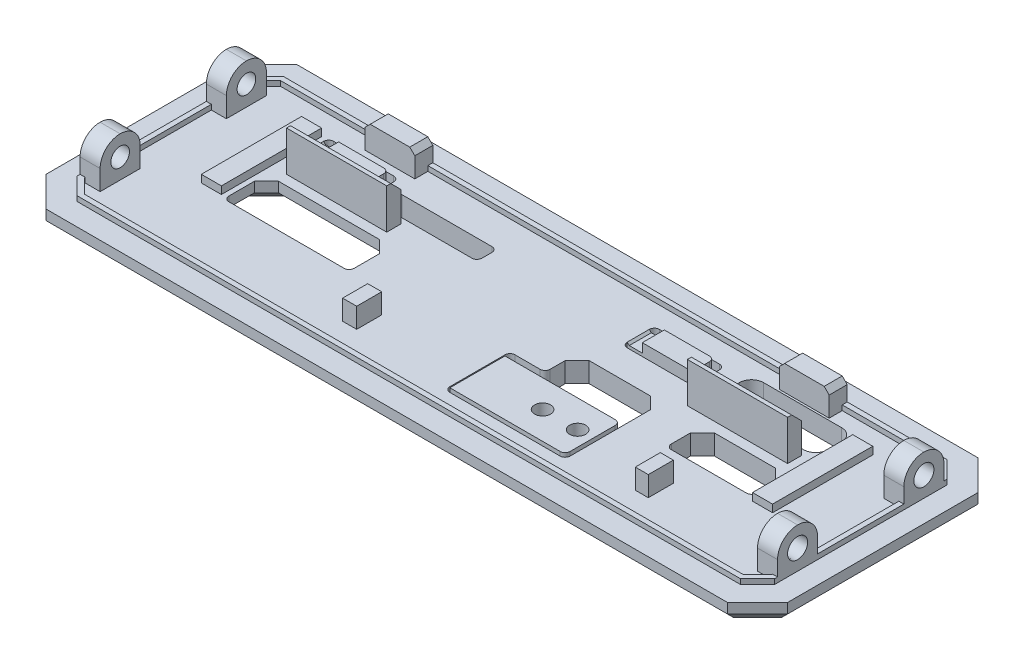
from build123d import *

# Parameters (mm, degrees)
EXTRUDE_1_DEPTH               = 2
CHAMFER_1_SIZE                = 1
CUT_EXTRUDE_1_REACH           = 46.22
SKETCH_3_W                    = 12.5
SKETCH_3_H                    = 4.25
SKETCH_3_W_2                  = 8.5
SKETCH_3_H_2                  = 3.6
SKETCH_3_W_3                  = 10.2
SKETCH_3_H_3                  = 3.8
SKETCH_3_W_4                  = 7
SKETCH_3_H_4                  = 3.2
SKETCH_3_W_5                  = 10
SKETCH_3_H_5                  = 2
FILLET_1_R                    = 1.2
FILLET_2_R                    = 0.5
CHAMFER_2_SIZE                = 1.2
SKETCH_4_W                    = 3.5
SKETCH_4_H                    = 2.2
EXTRUDE_2_DEPTH               = 1
SKETCH_4_W_2                  = 6.5
SKETCH_4_H_2                  = 5.5
EXTRUDE_2_2_DEPTH             = 1
SKETCH_4_W_3                  = 4.5
EXTRUDE_2_3_DEPTH             = 1
SKETCH_5_W                    = 6.5
SKETCH_5_H                    = 2.2
EXTRUDE_3_DEPTH               = 0.8
SKETCH_16_W                   = 5
SKETCH_16_H                   = 2.2
EXTRUDE_10_DEPTH              = 0.9
SKETCH_6_W                    = 11.5
SKETCH_6_H                    = 5.5
EXTRUDE_4_DEPTH               = 0.9
FILLET_5_R                    = 1
FILLET_3_R                    = 0.5
CHAMFER_3_SIZE                = 0.2
SKETCH_7_W                    = 1.4
SKETCH_7_H                    = 2.5
SKETCH_7_W_2                  = 1.3
EXTRUDE_5_DEPTH               = 2
SKETCH_11_W                   = 2
SKETCH_11_H                   = 10
EXTRUDE_7_DEPTH               = 0.75
SKETCH_8_W                    = 2
SKETCH_8_H                    = 4
EXTRUDE_6_DEPTH               = 4
FILLET_4_R                    = 2
SKETCH_9_R                    = 1
CUT_EXTRUDE_2_DEPTH           = 2
CUT_EXTRUDE_2_DRAFT           = -2
CUT_EXTRUDE_2_PROFILE_2_DEPTH = 2
CUT_EXTRUDE_2_PROFILE_2_DRAFT = -2
SKETCH_10_R                   = 1
CUT_EXTRUDE_3_DEPTH           = 2
CUT_EXTRUDE_3_DRAFT           = -2
CUT_EXTRUDE_3_PROFILE_2_DEPTH = 2
CUT_EXTRUDE_3_PROFILE_2_DRAFT = -2
CUT_EXTRUDE_4_REACH           = 46.58
SKETCH_14_R                   = 0.8
EXTRUDE_11_DEPTH              = 0.5
CHAMFER_6_SIZE                = 1
SKETCH_18_W                   = 10
SKETCH_18_H                   = 1.4
EXTRUDE_12_DEPTH              = 4
CHAMFER_7_SIZE                = 1
SKETCH_19_W                   = 4.95
SKETCH_19_H                   = 1.8
EXTRUDE_13_DEPTH              = 2.5
CHAMFER_8_SIZE                = 0.5


# Some blends are built 0.0001 mm under size
with BuildPart() as part:
    # 草图2 → 凸台-拉伸1 (new body)
    with BuildSketch(Plane(origin=(0, 0, 0), x_dir=(1, 0, 0), z_dir=(0, 1, 0))):
        Polygon((-36.762377201, 20.76395027), (-33.762377201, 23.76395027), (34.237622799, 23.76395027), (37.237622799, 20.76395027), (37.237622799, 1.76395027), (34.237622799, -1.23604973), (-33.762377201, -1.23604973), (-36.762377201, 1.76395027), align=None)
    extrude(amount=EXTRUDE_1_DEPTH)

    # 倒角1
    chamfer_1_edges = [part.edges().sort_by_distance(p)[0] for p in [
        (-35.262377201, 0, -0.26395027),
        (-36.762377201, 0, -11.26395027),
        (-35.262377201, 0, -22.26395027),
        (0.237622799, 0, -23.76395027),
        (35.737622799, 0, -22.26395027),
        (37.237622799, 0, -11.26395027),
        (35.737622799, 0, -0.26395027),
        (0.237622799, 0, 1.23604973),
    ]]
    chamfer(chamfer_1_edges, length=CHAMFER_1_SIZE)

    # 草图3 → 切除-拉伸1 (cut, up to next)
    with BuildSketch(Plane.XZ, mode=Mode.PRIVATE) as cut_extrude_1_sk1:
        with Locations((-19.512377201, -10.63895027)):
            Rectangle(SKETCH_3_W, SKETCH_3_H)
    cut_extrude_1_tool1 = extrude(cut_extrude_1_sk1.sketch, amount=-CUT_EXTRUDE_1_REACH, mode=Mode.PRIVATE) & part.part
    # 草图3 → 切除-拉伸1 (cut, up to next)
    with BuildSketch(Plane.XZ, mode=Mode.PRIVATE) as cut_extrude_1_sk2:
        Polygon((1.737622799, -3.06395027), (13.737622799, -3.06395027), (13.737622799, -12.76395027), (5.237622799, -12.76395027), (5.237622799, -9.56395027), (1.737622799, -9.56395027), align=None)
    cut_extrude_1_tool2 = extrude(cut_extrude_1_sk2.sketch, amount=-CUT_EXTRUDE_1_REACH, mode=Mode.PRIVATE) & part.part
    # 草图3 → 切除-拉伸1 (cut, up to next)
    with BuildSketch(Plane.XZ, mode=Mode.PRIVATE) as cut_extrude_1_sk3:
        with Locations((21.987622799, -10.96395027)):
            Rectangle(SKETCH_3_W_2, SKETCH_3_H_2)
    cut_extrude_1_tool3 = extrude(cut_extrude_1_sk3.sketch, amount=-CUT_EXTRUDE_1_REACH, mode=Mode.PRIVATE) & part.part
    # 草图3 → 切除-拉伸1 (cut, up to next)
    with BuildSketch(Plane.XZ, mode=Mode.PRIVATE) as cut_extrude_1_sk4:
        with Locations((20.937622799, -17.66395027)):
            Rectangle(SKETCH_3_W_3, SKETCH_3_H_3)
    cut_extrude_1_tool4 = extrude(cut_extrude_1_sk4.sketch, amount=-CUT_EXTRUDE_1_REACH, mode=Mode.PRIVATE) & part.part
    # 草图3 → 切除-拉伸1 (cut, up to next)
    with BuildSketch(Plane.XZ, mode=Mode.PRIVATE) as cut_extrude_1_sk5:
        with Locations((10.237622799, -17.36395027)):
            Rectangle(SKETCH_3_W_4, SKETCH_3_H_4)
    cut_extrude_1_tool5 = extrude(cut_extrude_1_sk5.sketch, amount=-CUT_EXTRUDE_1_REACH, mode=Mode.PRIVATE) & part.part
    # 草图3 → 切除-拉伸1 (cut, up to next)
    with BuildSketch(Plane.XZ, mode=Mode.PRIVATE) as cut_extrude_1_sk6:
        with Locations((-22.262377201, -17.36395027)):
            Rectangle(SKETCH_3_W_4, SKETCH_3_H_4)
    cut_extrude_1_tool6 = extrude(cut_extrude_1_sk6.sketch, amount=-CUT_EXTRUDE_1_REACH, mode=Mode.PRIVATE) & part.part
    # 草图3 → 切除-拉伸1 (cut, up to next)
    with BuildSketch(Plane.XZ, mode=Mode.PRIVATE) as cut_extrude_1_sk7:
        with Locations((-12.762377201, -16.76395027)):
            Rectangle(SKETCH_3_W_5, SKETCH_3_H_5)
    cut_extrude_1_tool7 = extrude(cut_extrude_1_sk7.sketch, amount=-CUT_EXTRUDE_1_REACH, mode=Mode.PRIVATE) & part.part
    add(cut_extrude_1_tool1.solids().sort_by_distance((-19.512377, 0, -10.63895))[0], mode=Mode.SUBTRACT)
    add(cut_extrude_1_tool2.solids().sort_by_distance((8.190094, 0, -7.567943))[0], mode=Mode.SUBTRACT)
    add(cut_extrude_1_tool3.solids().sort_by_distance((21.987623, 0, -10.96395))[0], mode=Mode.SUBTRACT)
    add(cut_extrude_1_tool4.solids().sort_by_distance((20.937623, 0, -17.66395))[0], mode=Mode.SUBTRACT)
    add(cut_extrude_1_tool5.solids().sort_by_distance((10.237623, 0, -17.36395))[0], mode=Mode.SUBTRACT)
    add(cut_extrude_1_tool6.solids().sort_by_distance((-22.262377, 0, -17.36395))[0], mode=Mode.SUBTRACT)
    add(cut_extrude_1_tool7.solids().sort_by_distance((-12.762377, 0, -16.76395))[0], mode=Mode.SUBTRACT)

    # 圆角1
    fillet_1_edges = [part.edges().sort_by_distance(p)[0] for p in [
        (15.837622799, 1, -19.56395027),
        (15.837622799, 1, -15.76395027),
        (26.037622799, 1, -15.76395027),
        (26.037622799, 1, -19.56395027),
    ]]
    fillet(fillet_1_edges, radius=FILLET_1_R)

    # 圆角2
    fillet_2_edges = [part.edges().sort_by_distance(p)[0] for p in [
        (17.737622799, 1, -9.16395027),
        (26.237622799, 1, -9.16395027),
        (1.737622799, 1, -9.56395027),
        (1.737622799, 1, -3.06395027),
        (13.737622799, 1, -3.06395027),
        (5.237622799, 1, -9.56395027),
        (-25.762377201, 1, -8.51395027),
        (-13.262377201, 1, -8.51395027),
        (-17.762377201, 1, -17.76395027),
        (-17.762377201, 1, -15.76395027),
        (-7.762377201, 1, -15.76395027),
        (-7.762377201, 1, -17.76395027),
        (-25.762377201, 1, -18.96395027),
        (-25.762377201, 1, -15.76395027),
        (-18.762377201, 1, -15.76395027),
        (-18.762377201, 1, -18.96395027),
        (6.737622799, 1, -18.96395027),
        (6.737622799, 1, -15.76395027),
        (13.737622799, 1, -15.76395027),
        (13.737622799, 1, -18.96395027),
    ]]
    fillet(fillet_2_edges, radius=FILLET_2_R)

    # 倒角2
    chamfer_2_edges = [part.edges().sort_by_distance(p)[0] for p in [
        (17.737622799, 1, -12.76395027),
        (26.237622799, 1, -12.76395027),
        (13.737622799, 1, -12.76395027),
        (5.237622799, 1, -12.76395027),
        (-25.762377201, 1, -12.76395027),
        (-13.262377201, 1, -12.76395027),
    ]]
    chamfer(chamfer_2_edges, length=CHAMFER_2_SIZE)



with BuildPart() as body_2:
    # 草图4 → 凸台-拉伸2 (new body)
    with BuildSketch(Plane.XZ):
        with Locations((-21.012377201, -17.36395027)):
            Rectangle(SKETCH_4_W, SKETCH_4_H)
    extrude(amount=-EXTRUDE_2_DEPTH)


with BuildPart() as body_3:
    # 草图4 → Extrude 2 2 (new body)
    with BuildSketch(Plane.XZ):
        with Locations((9.987622799, -6.31395027)):
            Rectangle(SKETCH_4_W_2, SKETCH_4_H_2)
    extrude(amount=-EXTRUDE_2_2_DEPTH)


with BuildPart() as body_4:
    # 草图4 → Extrude 2 3 (new body)
    with BuildSketch(Plane.XZ):
        with Locations((10.987622799, -17.36395027)):
            Rectangle(SKETCH_4_W_3, SKETCH_4_H)
    extrude(amount=-EXTRUDE_2_3_DEPTH)


with BuildPart() as part_1:
    add(part.part)

    add(body_2.part)  # 凸台-拉伸3 merges body 2

    add(body_4.part)  # 凸台-拉伸3 merges body 4
    # 草图5 → 凸台-拉伸3 (add)
    with BuildSketch(Plane(origin=(0, 1, 0), x_dir=(1, 0, 0), z_dir=(0, 1, 0))):
        with Locations((-22.512377201, 17.36395027)):
            Rectangle(SKETCH_5_W, SKETCH_5_H)
        with Locations((9.987622799, 17.36395027)):
            Rectangle(SKETCH_5_W, SKETCH_5_H)
    extrude(amount=EXTRUDE_3_DEPTH)

    # 草图16 → 凸台-拉伸10 (add)
    with BuildSketch(Plane(origin=(0, 1.8, 0), x_dir=(1, 0, 0), z_dir=(0, 1, 0))):
        with Locations((10.737622799, 17.36395027)):
            Rectangle(SKETCH_16_W, SKETCH_16_H)
        with Locations((-21.762377201, 17.36395027)):
            Rectangle(SKETCH_16_W, SKETCH_16_H)
    extrude(amount=EXTRUDE_10_DEPTH)


    add(body_3.part)  # 凸台-拉伸4 merges body 3
    # 草图6 → 凸台-拉伸4 (add)
    with BuildSketch(Plane(origin=(0, 1, 0), x_dir=(1, 0, 0), z_dir=(0, 1, 0))):
        with Locations((7.487622799, 6.31395027)):
            Rectangle(SKETCH_6_W, SKETCH_6_H)
    extrude(amount=EXTRUDE_4_DEPTH)

    # 圆角5
    fillet_5_edges = [part_1.edges().sort_by_distance(p)[0] for p in [
        (1.737622799, 1, -6.31395027),
        (6.737622799, 1, -17.36395027),
        (-25.762377201, 1, -17.36395027),
    ]]
    fillet(fillet_5_edges, radius=FILLET_5_R - 0.0001)  # a hair under: the kernel refuses the full size

    # 圆角3
    fillet_3_edges = [part_1.edges().sort_by_distance(p)[0] for p in [
        (-19.262377201, 1.35, -16.26395027),
        (-19.262377201, 1.35, -18.46395027),
        (-22.762377201, 0.5, -16.26395027),
        (-22.762377201, 0.5, -18.46395027),
        (13.237622799, 1.35, -16.26395027),
        (13.237622799, 1.35, -18.46395027),
        (8.737622799, 0.5, -16.26395027),
        (8.737622799, 0.5, -18.46395027),
        (6.737622799, 0.5, -9.06395027),
        (13.237622799, 0.95, -9.06395027),
        (13.237622799, 0.95, -3.56395027),
        (6.737622799, 0.5, -3.56395027),
    ]]
    fillet(fillet_3_edges, radius=FILLET_3_R)

    # 倒角3
    # the kernel refuses this chamfer: 0.2 mm, written as the material it adds along each edge
    with BuildSketch(Plane(origin=(-25.762377201, 1.8, -16.26395027), x_dir=(0.9996219169112968, -0.02749587661058658, 0), z_dir=(0, 0, -1))) as chamfer_3_piece_1_section:
        Polygon((CHAMFER_3_SIZE * 0.999621916911, -CHAMFER_3_SIZE * 0.0274958766106), (-CHAMFER_3_SIZE * 0.0274958766106, -CHAMFER_3_SIZE * 0.999621916911), (0, 0), align=None)
    chamfer_3_piece_1 = extrude(amount=2.2, mode=Mode.PRIVATE)
    chamfer_3_piece_1 = split(chamfer_3_piece_1, bisect_by=Plane(origin=(-25.696296371, 2, -17.36395027), z_dir=(0, -1, 0)), keep=Keep.TOP, mode=Mode.PRIVATE)
    add(chamfer_3_piece_1)
    with BuildSketch(Plane(origin=(6.737622799, 1.8, -16.26395027), x_dir=(0.9996219169112968, -0.027495876610586226, 0), z_dir=(0, 0, -1))) as chamfer_3_piece_2_section:
        Polygon((CHAMFER_3_SIZE * 0.999621916911, -CHAMFER_3_SIZE * 0.0274958766106), (-CHAMFER_3_SIZE * 0.0274958766106, -CHAMFER_3_SIZE * 0.999621916911), (0, 0), align=None)
    chamfer_3_piece_2 = extrude(amount=2.2, mode=Mode.PRIVATE)
    chamfer_3_piece_2 = split(chamfer_3_piece_2, bisect_by=Plane(origin=(6.803703629, 2, -17.36395027), z_dir=(0, -1, 0)), keep=Keep.TOP, mode=Mode.PRIVATE)
    add(chamfer_3_piece_2)

    # 草图7 → 凸台-拉伸5 (add)
    with BuildSketch(Plane(origin=(0, 2, 0), x_dir=(1, 0, 0), z_dir=(0, 1, 0))):
        with Locations((-8.562377201, 5.11395027)):
            Rectangle(SKETCH_7_W, SKETCH_7_H)
        with Locations((20.587622799, 5.11395027)):
            Rectangle(SKETCH_7_W_2, SKETCH_7_H)
    extrude(amount=EXTRUDE_5_DEPTH)

    # 草图11 → 凸台-拉伸7 (add)
    with BuildSketch(Plane(origin=(0, 2, 0), x_dir=(1, 0, 0), z_dir=(0, 1, 0))):
        with Locations((27.737622799, 13.76395027)):
            Rectangle(SKETCH_11_W, SKETCH_11_H)
        with Locations((-27.262377201, 13.76395027)):
            Rectangle(SKETCH_11_W, SKETCH_11_H)
    extrude(amount=EXTRUDE_7_DEPTH)

    # 草图8 → 凸台-拉伸6 (add)
    with BuildSketch(Plane(origin=(0, 2, 0), x_dir=(1, 0, 0), z_dir=(0, 1, 0))):
        with Locations((34.037622799, 4.96395027)):
            Rectangle(SKETCH_8_W, SKETCH_8_H)
        with Locations((34.037622799, 17.56395027)):
            Rectangle(SKETCH_8_W, SKETCH_8_H)
        with Locations((-33.562377201, 4.96395027)):
            Rectangle(SKETCH_8_W, SKETCH_8_H)
        with Locations((-33.562377201, 17.56395027)):
            Rectangle(SKETCH_8_W, SKETCH_8_H)
    extrude(amount=EXTRUDE_6_DEPTH)

    # 圆角4
    fillet_4_edges = [part_1.edges().sort_by_distance(p)[0] for p in [
        (34.037622799, 6, -6.96395027),
        (34.037622799, 6, -2.96395027),
        (34.037622799, 6, -19.56395027),
        (34.037622799, 6, -15.56395027),
        (-33.562377201, 6, -15.56395027),
        (-33.562377201, 6, -19.56395027),
        (-33.562377201, 6, -2.96395027),
        (-33.562377201, 6, -6.96395027),
    ]]
    fillet(fillet_4_edges, radius=FILLET_4_R - 0.0001)  # a hair under: the kernel refuses the full size


with BuildPart() as cut_extrude_2_tool:
    # 草图9 → 切除-拉伸2 (with draft: the straight prism first)
    with BuildSketch(Plane.ZY.offset(34.562377201)):
        with Locations((-4.96395027, 4)):
            Circle(SKETCH_9_R)
    extrude(amount=-CUT_EXTRUDE_2_DEPTH)
    # 切除-拉伸2: the draft: its side faces are tilted about the plane it starts from
    cut_extrude_2_sides = [cut_extrude_2_tool.faces().sort_by_distance(p)[0] for p in [
        (-33.562377201, 4, -5.96395027),
    ]]
    draft(cut_extrude_2_sides, Plane.ZY.offset(34.562377201), CUT_EXTRUDE_2_DRAFT)


with BuildPart() as part_2:
    add(part_1.part)

    # 切除-拉伸2: cut by cut_extrude_2_tool
    add(cut_extrude_2_tool.part, mode=Mode.SUBTRACT)


with BuildPart() as cut_extrude_2_profile_2_tool:
    # 草图9 → 切除-拉伸2 profile 2 (with draft: the straight prism first)
    with BuildSketch(Plane.ZY.offset(34.562377201)):
        with Locations((-17.56395027, 4)):
            Circle(SKETCH_9_R)
    extrude(amount=-CUT_EXTRUDE_2_PROFILE_2_DEPTH)
    # 切除-拉伸2 profile 2: the draft: its side faces are tilted about the plane it starts from
    cut_extrude_2_profile_2_sides = [cut_extrude_2_profile_2_tool.faces().sort_by_distance(p)[0] for p in [
        (-33.562377201, 4, -18.56395027),
    ]]
    draft(cut_extrude_2_profile_2_sides, Plane.ZY.offset(34.562377201), CUT_EXTRUDE_2_PROFILE_2_DRAFT)


with BuildPart() as part_3:
    add(part_2.part)

    # 切除-拉伸2 profile 2: cut by cut_extrude_2_profile_2_tool
    add(cut_extrude_2_profile_2_tool.part, mode=Mode.SUBTRACT)


with BuildPart() as cut_extrude_3_tool:
    # 草图10 → 切除-拉伸3 (with draft: the straight prism first)
    with BuildSketch(Plane(origin=(35.037622799, 0, 0), x_dir=(0, 0, -1), z_dir=(1, 0, 0))):
        with Locations((4.96395027, 4)):
            Circle(SKETCH_10_R)
    extrude(amount=-CUT_EXTRUDE_3_DEPTH)
    # 切除-拉伸3: the draft: its side faces are tilted about the plane it starts from
    cut_extrude_3_sides = [cut_extrude_3_tool.faces().sort_by_distance(p)[0] for p in [
        (34.037622799, 4, -3.96395027),
    ]]
    draft(cut_extrude_3_sides, Plane(origin=(35.037622799, 0, 0), x_dir=(0, 0, -1), z_dir=(1, 0, 0)), CUT_EXTRUDE_3_DRAFT)


with BuildPart() as part_4:
    add(part_3.part)

    # 切除-拉伸3: cut by cut_extrude_3_tool
    add(cut_extrude_3_tool.part, mode=Mode.SUBTRACT)


with BuildPart() as cut_extrude_3_profile_2_tool:
    # 草图10 → 切除-拉伸3 profile 2 (with draft: the straight prism first)
    with BuildSketch(Plane(origin=(35.037622799, 0, 0), x_dir=(0, 0, -1), z_dir=(1, 0, 0))):
        with Locations((17.56395027, 4)):
            Circle(SKETCH_10_R)
    extrude(amount=-CUT_EXTRUDE_3_PROFILE_2_DEPTH)
    # 切除-拉伸3 profile 2: the draft: its side faces are tilted about the plane it starts from
    cut_extrude_3_profile_2_sides = [cut_extrude_3_profile_2_tool.faces().sort_by_distance(p)[0] for p in [
        (34.037622799, 4, -16.56395027),
    ]]
    draft(cut_extrude_3_profile_2_sides, Plane(origin=(35.037622799, 0, 0), x_dir=(0, 0, -1), z_dir=(1, 0, 0)), CUT_EXTRUDE_3_PROFILE_2_DRAFT)


with BuildPart() as part_5:
    add(part_4.part)

    # 切除-拉伸3 profile 2: cut by cut_extrude_3_profile_2_tool
    add(cut_extrude_3_profile_2_tool.part, mode=Mode.SUBTRACT)

    # 草图14 → 切除-拉伸4 (cut, up to next)
    with BuildSketch(Plane.XZ, mode=Mode.PRIVATE) as cut_extrude_4_sk1:
        with Locations(Location((11.737622799, -6.31395027, 0), (0, 0, 270))):
            Circle(SKETCH_14_R)
    cut_extrude_4_tool1 = extrude(cut_extrude_4_sk1.sketch, amount=-CUT_EXTRUDE_4_REACH, mode=Mode.PRIVATE) & part_5.part
    # 草图14 → 切除-拉伸4 (cut, up to next)
    with BuildSketch(Plane.XZ, mode=Mode.PRIVATE) as cut_extrude_4_sk2:
        with Locations(Location((8.237622799, -6.31395027, 0), (0, 0, 270))):
            Circle(SKETCH_14_R)
    cut_extrude_4_tool2 = extrude(cut_extrude_4_sk2.sketch, amount=-CUT_EXTRUDE_4_REACH, mode=Mode.PRIVATE) & part_5.part
    add(cut_extrude_4_tool1.solids().sort_by_distance((11.737623, 0, -6.31395))[0], mode=Mode.SUBTRACT)
    add(cut_extrude_4_tool2.solids().sort_by_distance((8.237623, 0, -6.31395))[0], mode=Mode.SUBTRACT)

    # 草图17 → 凸台-拉伸11 (add)
    with BuildSketch(Plane(origin=(0, 2, 0), x_dir=(1, 0, 0), z_dir=(0, 1, 0))):
        Polygon((33.326352961, 21.56395027), (-32.851107364, 21.56395027), (-34.562377201, 19.852680433), (-34.562377201, 2.675220108), (-32.851107364, 0.96395027), (33.326352961, 0.96395027), (35.037622799, 2.675220108), (35.037622799, 19.852680433), align=None)
        Polygon((33.11924618, 21.06395027), (-32.644000583, 21.06395027), (-34.062377201, 19.645573652), (-34.062377201, 2.882326889), (-32.644000583, 1.46395027), (33.11924618, 1.46395027), (34.537622799, 2.882326889), (34.537622799, 19.645573652), align=None, mode=Mode.SUBTRACT)
    extrude(amount=EXTRUDE_11_DEPTH)

    # 倒角6
    chamfer_6_edges = [part_5.edges().sort_by_distance(p)[0] for p in [
        (-25.615930592, 0, -8.66039688),
        (-13.408823811, 0, -8.66039688),
        (-13.862377201, 0, -12.16395027),
        (-25.162377201, 0, -12.16395027),
        (-25.762377201, 0, -10.28895027),
        (-19.512377201, 0, -8.51395027),
        (-13.262377201, 0, -10.28895027),
        (-19.512377201, 0, -12.76395027),
    ]]
    chamfer(chamfer_6_edges, length=CHAMFER_6_SIZE)

    # 草图18 → 凸台-拉伸12 (add)
    with BuildSketch(Plane(origin=(0, 2, 0), x_dir=(1, 0, 0), z_dir=(0, 1, 0))):
        with Locations((20.237622799, 14.46395027)):
            Rectangle(SKETCH_18_W, SKETCH_18_H)
        with Locations((-19.762377201, 14.46395027)):
            Rectangle(SKETCH_18_W, SKETCH_18_H)
    extrude(amount=EXTRUDE_12_DEPTH)

    # 倒角7
    chamfer_7_edges = [part_5.edges().sort_by_distance(p)[0] for p in [
        (20.237622799, 6, -15.16395027),
        (-19.762377201, 6, -15.16395027),
    ]]
    chamfer(chamfer_7_edges, length=CHAMFER_7_SIZE)

    # 草图19 → 凸台-拉伸13 (add)
    with BuildSketch(Plane(origin=(0, 2, 0), x_dir=(1, 0, 0), z_dir=(0, 1, 0))):
        with Locations((20.912622799, 20.66395027)):
            Rectangle(SKETCH_19_W, SKETCH_19_H)
        with Locations((-20.437377201, 20.66395027)):
            Rectangle(SKETCH_19_W, SKETCH_19_H)
    extrude(amount=EXTRUDE_13_DEPTH)

    # 倒角8
    chamfer_8_edges = [part_5.edges().sort_by_distance(p)[0] for p in [
        (23.387622799, 4.5, -20.66395027),
        (18.437622799, 4.5, -20.66395027),
        (-17.962377201, 4.5, -20.66395027),
        (-22.912377201, 4.5, -20.66395027),
    ]]
    chamfer(chamfer_8_edges, length=CHAMFER_8_SIZE)


solid = part_5.part
